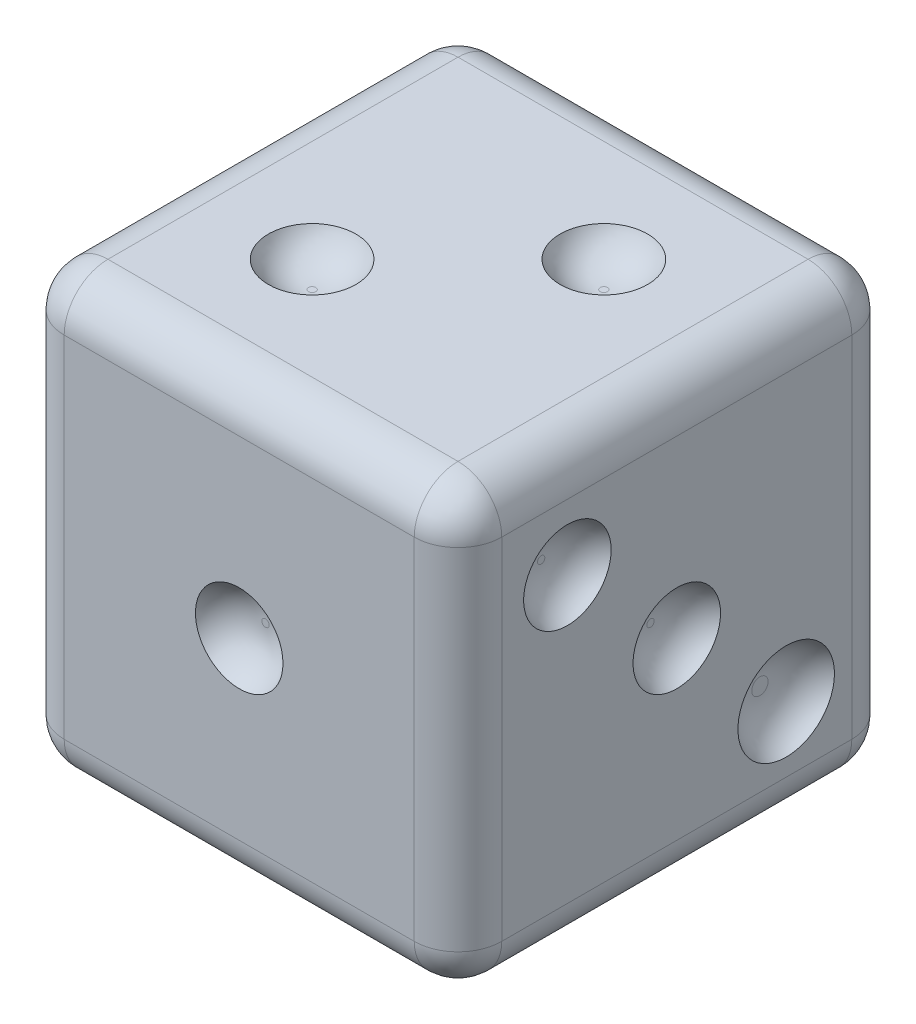
from build123d import *

# Parameters (mm, degrees)
SKETCH3_W           = 63.5
SKETCH3_H           = 63.5
BOSS_EXTRUDE2_DEPTH = 63.5
FILLET1_R           = 6.35
SKETCH4_R           = 6.35
CUT_EXTRUDE2_DEPTH  = 3.81
FILLET2_R           = 6.35
SKETCH6_R           = 6.35
SKETCH6_R_2         = 7.004789397
CUT_EXTRUDE3_DEPTH  = 3.81
FILLET3_R           = 6.35
SKETCH7_R           = 6.35
CUT_EXTRUDE4_DEPTH  = 3.81
FILLET4_R           = 6.35
SKETCH8_R           = 6.35
CUT_EXTRUDE5_DEPTH  = 3.81
FILLET5_R           = 6.35
SKETCH9_R           = 6.35
CUT_EXTRUDE6_DEPTH  = 3.81
FILLET6_R           = 6.35
SKETCH10_R          = 6.35
CUT_EXTRUDE7_DEPTH  = 3.81
FILLET7_R           = 6.35


with BuildPart() as part:
    # Sketch3 → Boss-Extrude2 (new body)
    with BuildSketch(Plane.YZ):
        Rectangle(SKETCH3_W, SKETCH3_H)
    extrude(amount=BOSS_EXTRUDE2_DEPTH)

    # Fillet1
    fillet1_edges = [part.edges().sort_by_distance(p)[0] for p in [
        (63.5, 31.75, 0),
        (63.5, 0, -31.75),
        (63.5, -31.75, 0),
        (0, 0, -31.75),
        (0, 31.75, 0),
        (0, 0, 31.75),
        (0, -31.75, 0),
        (31.75, -31.75, -31.75),
        (31.75, 31.75, -31.75),
        (31.75, 31.75, 31.75),
        (31.75, -31.75, 31.75),
        (63.5, 0, 31.75),
    ]]
    fillet(fillet1_edges, radius=FILLET1_R)

    # Sketch4 → Cut-Extrude2 (cut)
    with BuildSketch(Plane.XY.offset(31.75)):
        with Locations((31.75, 0)):
            Circle(SKETCH4_R)
    extrude(amount=-CUT_EXTRUDE2_DEPTH, mode=Mode.SUBTRACT)

    # Fillet2
    # the kernel refuses this fillet: 6.35 mm, written as the material it adds along each edge
    with BuildSketch(Plane(origin=(31.75, 0, 27.94), x_dir=(1, 0, 0), z_dir=(0, -1, 0))) as fillet2_piece_1:
        with BuildLine():
            CenterArc((0.530128867, 6.35), FILLET2_R, 270, 66.421821522)
            Line((0.530128867, 0), (0.530128867, -0.127))
            Line((0.530128867, -0.127), (6.35, -0.127))
            Line((6.35, -0.127), (6.477, 0))
            ThreePointArc((6.477, 0), (6.477, 1.905), (6.466397423, 3.7592))
            Line((6.466397423, 3.7592), (6.35, 3.81))
        make_face()
    revolve(axis=Axis((31.75, 0, 27.94), (0, 0, 1)))

    # Sketch6 → Cut-Extrude3 (cut)
    with BuildSketch(Plane.YZ.offset(63.5)):
        with Locations(Location((0, 0, 0), (0, 0, 270))):
            Circle(SKETCH6_R)
        with Locations(Location((15.875, 15.875, 0), (0, 0, 270))):
            Circle(SKETCH6_R)
        with Locations(Location((-15.875, -15.875, 0), (0, 0, 270))):
            Circle(SKETCH6_R_2)
    extrude(amount=-CUT_EXTRUDE3_DEPTH, mode=Mode.SUBTRACT)

    # Fillet3
    # the kernel refuses this fillet: 6.35 mm, written as the material it adds along each edge
    with BuildSketch(Plane(origin=(59.69, -15.875, -15.875), x_dir=(0, 0, -1), z_dir=(0, -1, 0))) as fillet3_piece_1:
        with BuildLine():
            CenterArc((1.184918264, 6.35), FILLET3_R, 270, 66.421821522)
            Line((1.184918264, 0), (1.184918264, -0.127))
            Line((1.184918264, -0.127), (7.004789397, -0.127))
            Line((7.004789397, -0.127), (7.131789397, 0))
            ThreePointArc((7.131789397, 0), (7.131789397, 1.905), (7.12118682, 3.7592))
            Line((7.12118682, 3.7592), (7.004789397, 3.81))
        make_face()
    revolve(axis=Axis((59.69, -15.875, -15.875), (1, 0, 0)))
    with BuildSketch(Plane(origin=(59.69, 0, 0), x_dir=(0, 0, -1), z_dir=(0, -1, 0))) as fillet3_piece_2:
        with BuildLine():
            CenterArc((0.530128867, 6.35), FILLET3_R, 270, 66.421821522)
            Line((0.530128867, 0), (0.530128867, -0.127))
            Line((0.530128867, -0.127), (6.35, -0.127))
            Line((6.35, -0.127), (6.477, 0))
            ThreePointArc((6.477, 0), (6.477, 1.905), (6.466397423, 3.7592))
            Line((6.466397423, 3.7592), (6.35, 3.81))
        make_face()
    revolve(axis=Axis((59.69, 0, 0), (1, 0, 0)))
    with BuildSketch(Plane(origin=(59.69, 15.875, 15.875), x_dir=(0, 0, -1), z_dir=(0, -1, 0))) as fillet3_piece_3:
        with BuildLine():
            CenterArc((0.530128867, 6.35), FILLET3_R, 270, 66.421821522)
            Line((0.530128867, 0), (0.530128867, -0.127))
            Line((0.530128867, -0.127), (6.35, -0.127))
            Line((6.35, -0.127), (6.477, 0))
            ThreePointArc((6.477, 0), (6.477, 1.905), (6.466397423, 3.7592))
            Line((6.466397423, 3.7592), (6.35, 3.81))
        make_face()
    revolve(axis=Axis((59.69, 15.875, 15.875), (1, 0, 0)))

    # Sketch7 → Cut-Extrude4 (cut)
    with BuildSketch(Plane(origin=(0, 31.75, 0), x_dir=(-1, 0, 0), z_dir=(0, 1, 0))):
        with Locations(Location((-21.16582, 10.58418, 0), (0, 0, 90))):
            Circle(SKETCH7_R)
        with Locations(Location((-42.33418, -10.58418, 0), (0, 0, 90))):
            Circle(SKETCH7_R)
    extrude(amount=-CUT_EXTRUDE4_DEPTH, mode=Mode.SUBTRACT)

    # Fillet4
    # the kernel refuses this fillet: 6.35 mm, written as the material it adds along each edge
    with BuildSketch(Plane(origin=(42.33418, 27.94, -10.58418), x_dir=(0, 0, 1), z_dir=(-1, 0, 0))) as fillet4_piece_1:
        with BuildLine():
            CenterArc((0.530128867, 6.35), FILLET4_R, 270, 66.421821522)
            Line((0.530128867, 0), (0.530128867, -0.127))
            Line((0.530128867, -0.127), (6.35, -0.127))
            Line((6.35, -0.127), (6.477, 0))
            ThreePointArc((6.477, 0), (6.477, 1.905), (6.466397423, 3.7592))
            Line((6.466397423, 3.7592), (6.35, 3.81))
        make_face()
    revolve(axis=Axis((42.33418, 27.94, -10.58418), (0, 1, 0)))
    with BuildSketch(Plane(origin=(21.16582, 27.94, 10.58418), x_dir=(0, 0, 1), z_dir=(-1, 0, 0))) as fillet4_piece_2:
        with BuildLine():
            CenterArc((0.530128867, 6.35), FILLET4_R, 270, 66.421821522)
            Line((0.530128867, 0), (0.530128867, -0.127))
            Line((0.530128867, -0.127), (6.35, -0.127))
            Line((6.35, -0.127), (6.477, 0))
            ThreePointArc((6.477, 0), (6.477, 1.905), (6.466397423, 3.7592))
            Line((6.466397423, 3.7592), (6.35, 3.81))
        make_face()
    revolve(axis=Axis((21.16582, 27.94, 10.58418), (0, 1, 0)))

    # Sketch8 → Cut-Extrude5 (cut)
    with BuildSketch(Plane.XZ.offset(31.75)):
        with Locations(Location((19.05, 12.7, 0), (0, 0, 270))):
            Circle(SKETCH8_R)
        with Locations(Location((44.45, 12.7, 0), (0, 0, 270))):
            Circle(SKETCH8_R)
        with Locations(Location((44.45, -12.7, 0), (0, 0, 270))):
            Circle(SKETCH8_R)
        with Locations(Location((19.05, -12.7, 0), (0, 0, 270))):
            Circle(SKETCH8_R)
    extrude(amount=-CUT_EXTRUDE5_DEPTH, mode=Mode.SUBTRACT)

    # Fillet5
    # the kernel refuses this fillet: 6.35 mm, written as the material it adds along each edge
    with BuildSketch(Plane(origin=(44.45, -27.94, -12.7), x_dir=(0, 0, -1), z_dir=(-1, 0, 0))) as fillet5_piece_1:
        with BuildLine():
            CenterArc((0.530128867, 6.35), FILLET5_R, 270, 66.421821522)
            Line((0.530128867, 0), (0.530128867, -0.127))
            Line((0.530128867, -0.127), (6.35, -0.127))
            Line((6.35, -0.127), (6.477, 0))
            ThreePointArc((6.477, 0), (6.477, 1.905), (6.466397423, 3.7592))
            Line((6.466397423, 3.7592), (6.35, 3.81))
        make_face()
    revolve(axis=Axis((44.45, -27.94, -12.7), (0, -1, 0)))
    with BuildSketch(Plane(origin=(19.05, -27.94, -12.7), x_dir=(0, 0, -1), z_dir=(-1, 0, 0))) as fillet5_piece_2:
        with BuildLine():
            CenterArc((0.530128867, 6.35), FILLET5_R, 270, 66.421821522)
            Line((0.530128867, 0), (0.530128867, -0.127))
            Line((0.530128867, -0.127), (6.35, -0.127))
            Line((6.35, -0.127), (6.477, 0))
            ThreePointArc((6.477, 0), (6.477, 1.905), (6.466397423, 3.7592))
            Line((6.466397423, 3.7592), (6.35, 3.81))
        make_face()
    revolve(axis=Axis((19.05, -27.94, -12.7), (0, -1, 0)))
    with BuildSketch(Plane(origin=(19.05, -27.94, 12.7), x_dir=(0, 0, -1), z_dir=(-1, 0, 0))) as fillet5_piece_3:
        with BuildLine():
            CenterArc((0.530128867, 6.35), FILLET5_R, 270, 66.421821522)
            Line((0.530128867, 0), (0.530128867, -0.127))
            Line((0.530128867, -0.127), (6.35, -0.127))
            Line((6.35, -0.127), (6.477, 0))
            ThreePointArc((6.477, 0), (6.477, 1.905), (6.466397423, 3.7592))
            Line((6.466397423, 3.7592), (6.35, 3.81))
        make_face()
    revolve(axis=Axis((19.05, -27.94, 12.7), (0, -1, 0)))
    with BuildSketch(Plane(origin=(44.45, -27.94, 12.7), x_dir=(0, 0, -1), z_dir=(-1, 0, 0))) as fillet5_piece_4:
        with BuildLine():
            CenterArc((0.530128867, 6.35), FILLET5_R, 270, 66.421821522)
            Line((0.530128867, 0), (0.530128867, -0.127))
            Line((0.530128867, -0.127), (6.35, -0.127))
            Line((6.35, -0.127), (6.477, 0))
            ThreePointArc((6.477, 0), (6.477, 1.905), (6.466397423, 3.7592))
            Line((6.466397423, 3.7592), (6.35, 3.81))
        make_face()
    revolve(axis=Axis((44.45, -27.94, 12.7), (0, -1, 0)))

    # Sketch9 → Cut-Extrude6 (cut)
    with BuildSketch(Plane(origin=(0, 0, 0), x_dir=(0, -1, 0), z_dir=(-1, 0, 0))):
        with Locations(Location((0, 0, 0), (0, 0, 90))):
            Circle(SKETCH9_R)
        with Locations(Location((15.875, 15.875, 0), (0, 0, 90))):
            Circle(SKETCH9_R)
        with Locations(Location((-15.875, 15.875, 0), (0, 0, 90))):
            Circle(SKETCH9_R)
        with Locations(Location((15.875, -15.875, 0), (0, 0, 90))):
            Circle(SKETCH9_R)
        with Locations(Location((-15.875, -15.875, 0), (0, 0, 90))):
            Circle(SKETCH9_R)
    extrude(amount=-CUT_EXTRUDE6_DEPTH, mode=Mode.SUBTRACT)

    # Fillet6
    # the kernel refuses this fillet: 6.35 mm, written as the material it adds along each edge
    with BuildSketch(Plane(origin=(3.81, -15.875, 15.875), x_dir=(0, 0, 1), z_dir=(0, -1, 0))) as fillet6_piece_1:
        with BuildLine():
            CenterArc((0.530128867, 6.35), FILLET6_R, 270, 66.421821522)
            Line((0.530128867, 0), (0.530128867, -0.127))
            Line((0.530128867, -0.127), (6.35, -0.127))
            Line((6.35, -0.127), (6.477, 0))
            ThreePointArc((6.477, 0), (6.477, 1.905), (6.466397423, 3.7592))
            Line((6.466397423, 3.7592), (6.35, 3.81))
        make_face()
    revolve(axis=Axis((3.81, -15.875, 15.875), (-1, 0, 0)))
    with BuildSketch(Plane(origin=(3.81, 15.875, -15.875), x_dir=(0, 0, 1), z_dir=(0, -1, 0))) as fillet6_piece_2:
        with BuildLine():
            CenterArc((0.530128867, 6.35), FILLET6_R, 270, 66.421821522)
            Line((0.530128867, 0), (0.530128867, -0.127))
            Line((0.530128867, -0.127), (6.35, -0.127))
            Line((6.35, -0.127), (6.477, 0))
            ThreePointArc((6.477, 0), (6.477, 1.905), (6.466397423, 3.7592))
            Line((6.466397423, 3.7592), (6.35, 3.81))
        make_face()
    revolve(axis=Axis((3.81, 15.875, -15.875), (-1, 0, 0)))
    with BuildSketch(Plane(origin=(3.81, -15.875, -15.875), x_dir=(0, 0, 1), z_dir=(0, -1, 0))) as fillet6_piece_3:
        with BuildLine():
            CenterArc((0.530128867, 6.35), FILLET6_R, 270, 66.421821522)
            Line((0.530128867, 0), (0.530128867, -0.127))
            Line((0.530128867, -0.127), (6.35, -0.127))
            Line((6.35, -0.127), (6.477, 0))
            ThreePointArc((6.477, 0), (6.477, 1.905), (6.466397423, 3.7592))
            Line((6.466397423, 3.7592), (6.35, 3.81))
        make_face()
    revolve(axis=Axis((3.81, -15.875, -15.875), (-1, 0, 0)))
    with BuildSketch(Plane(origin=(3.81, 15.875, 15.875), x_dir=(0, 0, 1), z_dir=(0, -1, 0))) as fillet6_piece_4:
        with BuildLine():
            CenterArc((0.530128867, 6.35), FILLET6_R, 270, 66.421821522)
            Line((0.530128867, 0), (0.530128867, -0.127))
            Line((0.530128867, -0.127), (6.35, -0.127))
            Line((6.35, -0.127), (6.477, 0))
            ThreePointArc((6.477, 0), (6.477, 1.905), (6.466397423, 3.7592))
            Line((6.466397423, 3.7592), (6.35, 3.81))
        make_face()
    revolve(axis=Axis((3.81, 15.875, 15.875), (-1, 0, 0)))
    with BuildSketch(Plane(origin=(3.81, 0, 0), x_dir=(0, 0, 1), z_dir=(0, -1, 0))) as fillet6_piece_5:
        with BuildLine():
            CenterArc((0.530128867, 6.35), FILLET6_R, 270, 66.421821522)
            Line((0.530128867, 0), (0.530128867, -0.127))
            Line((0.530128867, -0.127), (6.35, -0.127))
            Line((6.35, -0.127), (6.477, 0))
            ThreePointArc((6.477, 0), (6.477, 1.905), (6.466397423, 3.7592))
            Line((6.466397423, 3.7592), (6.35, 3.81))
        make_face()
    revolve(axis=Axis((3.81, 0, 0), (-1, 0, 0)))

    # Sketch10 → Cut-Extrude7 (cut)
    with BuildSketch(Plane(origin=(0, 0, -31.75), x_dir=(1, 0, 0), z_dir=(0, 0, -1))):
        with Locations(Location((31.75, -12.7, 0), (0, 0, 180))):
            Circle(SKETCH10_R)
        with Locations(Location((15.875, -12.7, 0), (0, 0, 180))):
            Circle(SKETCH10_R)
        with Locations(Location((47.625, -12.7, 0), (0, 0, 180))):
            Circle(SKETCH10_R)
        with Locations(Location((47.625, 12.7, 0), (0, 0, 180))):
            Circle(SKETCH10_R)
        with Locations(Location((31.75, 12.7, 0), (0, 0, 180))):
            Circle(SKETCH10_R)
        with Locations(Location((15.875, 12.7, 0), (0, 0, 180))):
            Circle(SKETCH10_R)
    extrude(amount=-CUT_EXTRUDE7_DEPTH, mode=Mode.SUBTRACT)

    # Fillet7
    # the kernel refuses this fillet: 6.35 mm, written as the material it adds along each edge
    with BuildSketch(Plane(origin=(47.625, 12.7, -27.94), x_dir=(-1, 0, 0), z_dir=(0, -1, 0))) as fillet7_piece_1:
        with BuildLine():
            CenterArc((0.530128867, 6.35), FILLET7_R, 270, 66.421821522)
            Line((0.530128867, 0), (0.530128867, -0.127))
            Line((0.530128867, -0.127), (6.35, -0.127))
            Line((6.35, -0.127), (6.477, 0))
            ThreePointArc((6.477, 0), (6.477, 1.905), (6.466397423, 3.7592))
            Line((6.466397423, 3.7592), (6.35, 3.81))
        make_face()
    revolve(axis=Axis((47.625, 12.7, -27.94), (0, 0, -1)))
    with BuildSketch(Plane(origin=(31.75, -12.7, -27.94), x_dir=(-1, 0, 0), z_dir=(0, -1, 0))) as fillet7_piece_2:
        with BuildLine():
            CenterArc((0.530128867, 6.35), FILLET7_R, 270, 66.421821522)
            Line((0.530128867, 0), (0.530128867, -0.127))
            Line((0.530128867, -0.127), (6.35, -0.127))
            Line((6.35, -0.127), (6.477, 0))
            ThreePointArc((6.477, 0), (6.477, 1.905), (6.466397423, 3.7592))
            Line((6.466397423, 3.7592), (6.35, 3.81))
        make_face()
    revolve(axis=Axis((31.75, -12.7, -27.94), (0, 0, -1)))
    with BuildSketch(Plane(origin=(15.875, -12.7, -27.94), x_dir=(-1, 0, 0), z_dir=(0, -1, 0))) as fillet7_piece_3:
        with BuildLine():
            CenterArc((0.530128867, 6.35), FILLET7_R, 270, 66.421821522)
            Line((0.530128867, 0), (0.530128867, -0.127))
            Line((0.530128867, -0.127), (6.35, -0.127))
            Line((6.35, -0.127), (6.477, 0))
            ThreePointArc((6.477, 0), (6.477, 1.905), (6.466397423, 3.7592))
            Line((6.466397423, 3.7592), (6.35, 3.81))
        make_face()
    revolve(axis=Axis((15.875, -12.7, -27.94), (0, 0, -1)))
    with BuildSketch(Plane(origin=(31.75, 12.7, -27.94), x_dir=(-1, 0, 0), z_dir=(0, -1, 0))) as fillet7_piece_4:
        with BuildLine():
            CenterArc((0.530128867, 6.35), FILLET7_R, 270, 66.421821522)
            Line((0.530128867, 0), (0.530128867, -0.127))
            Line((0.530128867, -0.127), (6.35, -0.127))
            Line((6.35, -0.127), (6.477, 0))
            ThreePointArc((6.477, 0), (6.477, 1.905), (6.466397423, 3.7592))
            Line((6.466397423, 3.7592), (6.35, 3.81))
        make_face()
    revolve(axis=Axis((31.75, 12.7, -27.94), (0, 0, -1)))
    with BuildSketch(Plane(origin=(47.625, -12.7, -27.94), x_dir=(-1, 0, 0), z_dir=(0, -1, 0))) as fillet7_piece_5:
        with BuildLine():
            CenterArc((0.530128867, 6.35), FILLET7_R, 270, 66.421821522)
            Line((0.530128867, 0), (0.530128867, -0.127))
            Line((0.530128867, -0.127), (6.35, -0.127))
            Line((6.35, -0.127), (6.477, 0))
            ThreePointArc((6.477, 0), (6.477, 1.905), (6.466397423, 3.7592))
            Line((6.466397423, 3.7592), (6.35, 3.81))
        make_face()
    revolve(axis=Axis((47.625, -12.7, -27.94), (0, 0, -1)))
    with BuildSketch(Plane(origin=(15.875, 12.7, -27.94), x_dir=(-1, 0, 0), z_dir=(0, -1, 0))) as fillet7_piece_6:
        with BuildLine():
            CenterArc((0.530128867, 6.35), FILLET7_R, 270, 66.421821522)
            Line((0.530128867, 0), (0.530128867, -0.127))
            Line((0.530128867, -0.127), (6.35, -0.127))
            Line((6.35, -0.127), (6.477, 0))
            ThreePointArc((6.477, 0), (6.477, 1.905), (6.466397423, 3.7592))
            Line((6.466397423, 3.7592), (6.35, 3.81))
        make_face()
    revolve(axis=Axis((15.875, 12.7, -27.94), (0, 0, -1)))


solid = part.part
